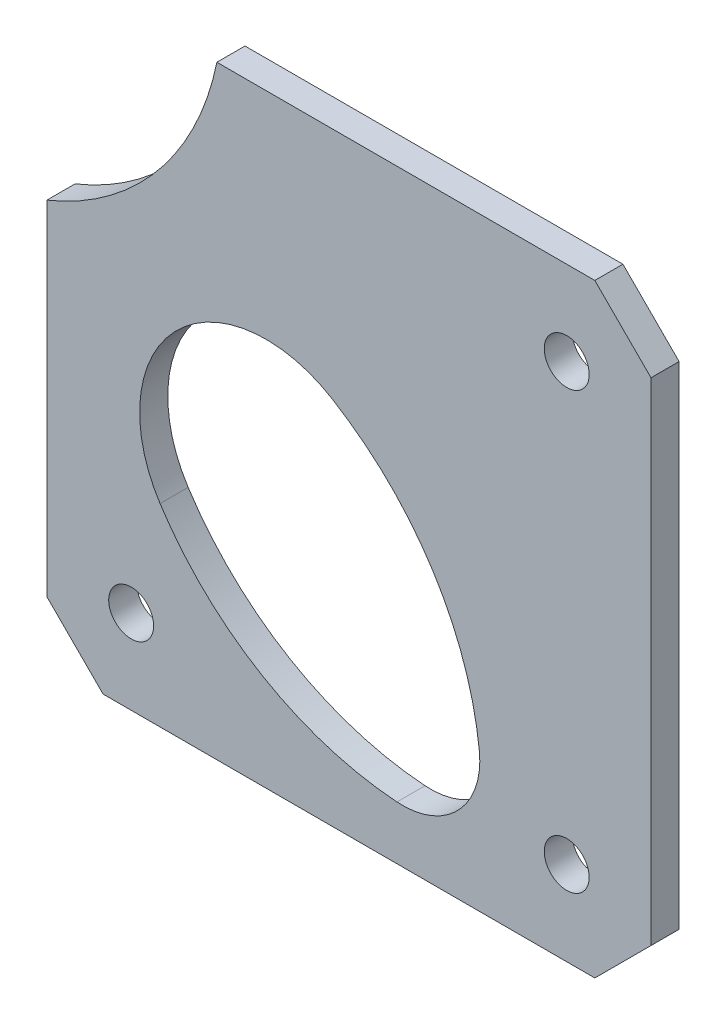
from build123d import *

# Parameters (mm, degrees)
CROQUIS1_W              = 60
CROQUIS1_H              = 60
SALIENTE_EXTRUIR1_DEPTH = 2
CROQUIS7_R              = 1.6
CORTAR_EXTRUIR1_DEPTH   = 85.876380696
CROQUIS8_OUTSIDE_W      = 78.976
CROQUIS8_OUTSIDE_H      = 78.976
CORTAR_EXTRUIR2_DEPTH   = 10
CORTAR_EXTRUIR4_DEPTH   = 73.859453745
CHAFL_N1_SIZE           = 4


with BuildPart() as part:
    # Croquis1 → Saliente-Extruir1 (new body)
    with BuildSketch(Plane.XY):
        with Locations((30, 30)):
            Rectangle(CROQUIS1_W, CROQUIS1_H)
    extrude(amount=SALIENTE_EXTRUIR1_DEPTH)

    # Croquis7 → Cortar-Extruir1 (cut, through all)
    with BuildSketch(Plane.XY.offset(2)):
        with Locations((14.5, 45.5)):
            Circle(CROQUIS7_R)
        with Locations((45.5, 45.5)):
            Circle(CROQUIS7_R)
        with Locations((14.5, 14.5)):
            Circle(CROQUIS7_R)
        with Locations((45.5, 14.5)):
            Circle(CROQUIS7_R)
    extrude(amount=-CORTAR_EXTRUIR1_DEPTH, mode=Mode.SUBTRACT)

    # Croquis8 outside → Cortar-Extruir2 (cut)
    with BuildSketch(Plane(origin=(0, 0, 0), x_dir=(-1, 0, 0), z_dir=(0, 0, -1))):
        with Locations((-30, 30)):
            Rectangle(CROQUIS8_OUTSIDE_W, CROQUIS8_OUTSIDE_H)
        with BuildLine():
            Line((-51.5, 51.5), (-51.5, 8.5))
            Line((-51.5, 8.5), (-8.5, 8.5))
            Line((-8.5, 8.5), (-8.5, 36.95))
            ThreePointArc((-8.5, 36.95), (-16.379748932, 42.703353122), (-20.6, 51.5))
            Line((-20.6, 51.5), (-51.5, 51.5))
        make_face(mode=Mode.SUBTRACT)
    extrude(amount=-CORTAR_EXTRUIR2_DEPTH, mode=Mode.SUBTRACT)

    # Croquis10 → Cortar-Extruir4 (cut, through all)
    with BuildSketch(Plane(origin=(0, 0, 0), x_dir=(-1, 0, 0), z_dir=(0, 0, -1))):
        with BuildLine():
            ThreePointArc((-39.282790937, 18.384108052), (-37.770757205, 13.974782814), (-33.416887225, 12.30978694))
            ThreePointArc((-33.416887225, 12.30978694), (-23.815977303, 15.311202908), (-16.554661394, 22.2724715))
            ThreePointArc((-16.554661394, 22.2724715), (-17.629242795, 33.425217186), (-28.737692181, 34.888369193))
            ThreePointArc((-28.737692181, 34.888369193), (-35.948136426, 27.874421452), (-39.282790937, 18.384108052))
        make_face()
    extrude(amount=-CORTAR_EXTRUIR4_DEPTH, mode=Mode.SUBTRACT)

    # Chaflán1
    chafl_n1_edges = [part.edges().sort_by_distance(p)[0] for p in [
        (8.5, 8.5, 1),
        (51.5, 8.5, 1),
        (51.5, 51.5, 1),
    ]]
    chamfer(chafl_n1_edges, length=CHAFL_N1_SIZE)


solid = part.part
